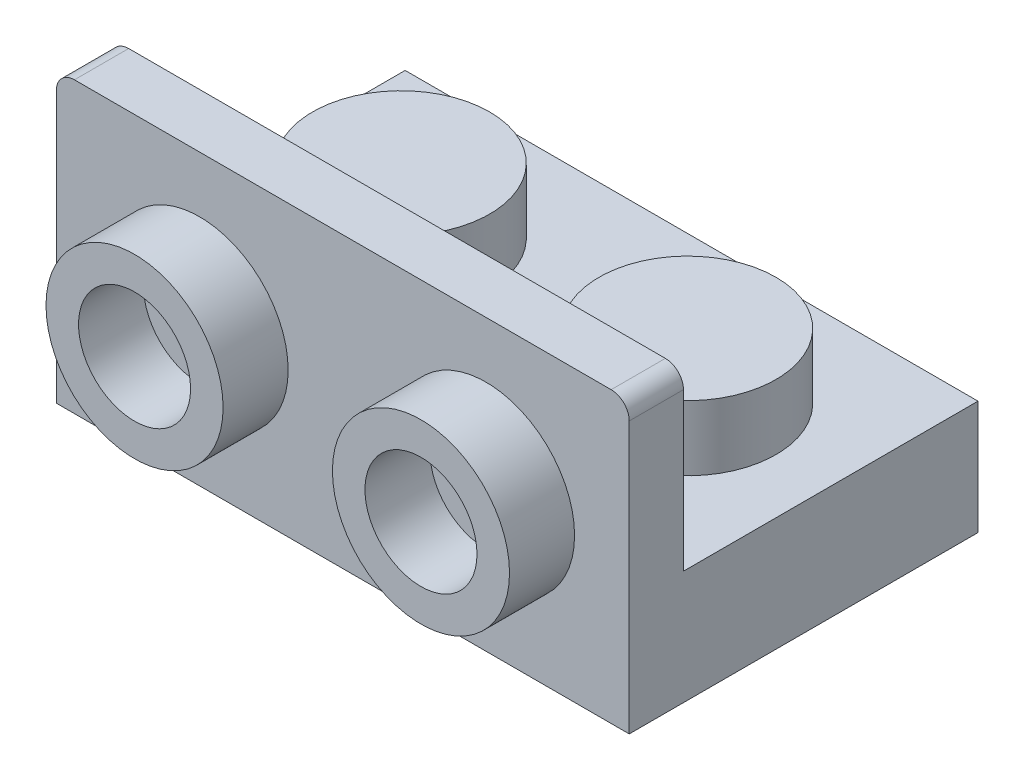
from build123d import *

# Parameters (mm, degrees)
BOSS_EXTRUDE1_DEPTH = 15.85
SKETCH2_R           = 2.45
SKETCH2_R_2         = 1.55
BOSS_EXTRUDE2_DEPTH = 1.8
SKETCH3_R           = 2.45
BOSS_EXTRUDE3_DEPTH = 1.8
SHELL1_OUTLINE_W    = 12.85
SHELL1_OUTLINE_H    = 6.65
SHELL1_DEPTH        = 1.65
SHELL1_START        = 1.65
SHELL1_2_OUTLINE_R  = 0.95
SHELL1_2_DEPTH      = 1.8
FILLET1_R           = 0.5


# Read off the part's stored shape, not the designer's step: Shell1
with BuildPart() as part:
    # Sketch1 → Boss-Extrude1 (new body)
    with BuildSketch(Plane(origin=(0, 0, 0), x_dir=(0, 0, -1), z_dir=(1, 0, 0))):
        Polygon((0, 0), (0, 8), (1.5, 8), (1.5, 3.15), (9.65, 3.15), (9.65, 0), align=None)
    extrude(amount=-BOSS_EXTRUDE1_DEPTH)

    # Sketch2 → Boss-Extrude2 (add)
    # profile 1 of 2: a face of its own
    with BuildSketch(Plane.XY):
        with Locations((-11.8875, 4)):
            Circle(SKETCH2_R)
        with Locations((-11.8875, 4)):
            Circle(SKETCH2_R_2, mode=Mode.SUBTRACT)
    # profile 2 of 2: a face of its own
    with BuildSketch(Plane.XY):
        with Locations((-3.9625, 4)):
            Circle(SKETCH2_R)
        with Locations((-3.9625, 4)):
            Circle(SKETCH2_R_2, mode=Mode.SUBTRACT)
    extrude(amount=BOSS_EXTRUDE2_DEPTH)

    # Sketch3 → Boss-Extrude3 (add)
    with BuildSketch(Plane(origin=(0, 3.15, 0), x_dir=(1, 0, 0), z_dir=(0, 1, 0))):
        with Locations(Location((-11.8875, 5.575, 0), (0, 0, 270))):
            Circle(SKETCH3_R)
        with Locations(Location((-3.9625, 5.575, 0), (0, 0, 270))):
            Circle(SKETCH3_R)
    extrude(amount=BOSS_EXTRUDE3_DEPTH)

    # Shell1 outline → Shell1 (cut)
    with BuildSketch(Plane(origin=(0, 0, 0), x_dir=(1, 0, 0), z_dir=(0, 1, 0))):
        with Locations((-7.925, 4.825)):
            Rectangle(SHELL1_OUTLINE_W, SHELL1_OUTLINE_H)
    extrude(amount=SHELL1_DEPTH, mode=Mode.SUBTRACT)

    # Shell1 2 outline → Shell1 2 (cut)
    with BuildSketch(Plane(origin=(0, 0, 0), x_dir=(1, 0, 0), z_dir=(0, 1, 0)).offset(SHELL1_START)):
        with Locations((-11.8875, 5.575)):
            Circle(SHELL1_2_OUTLINE_R)
        with Locations((-3.9625, 5.575)):
            Circle(SHELL1_2_OUTLINE_R)
    extrude(amount=SHELL1_2_DEPTH, mode=Mode.SUBTRACT)

    # Fillet1
    fillet1_edges = [part.edges().sort_by_distance(p)[0] for p in [
        (-15.85, 8, -0.75),
        (0, 8, -0.75),
    ]]
    fillet(fillet1_edges, radius=FILLET1_R)


solid = part.part
